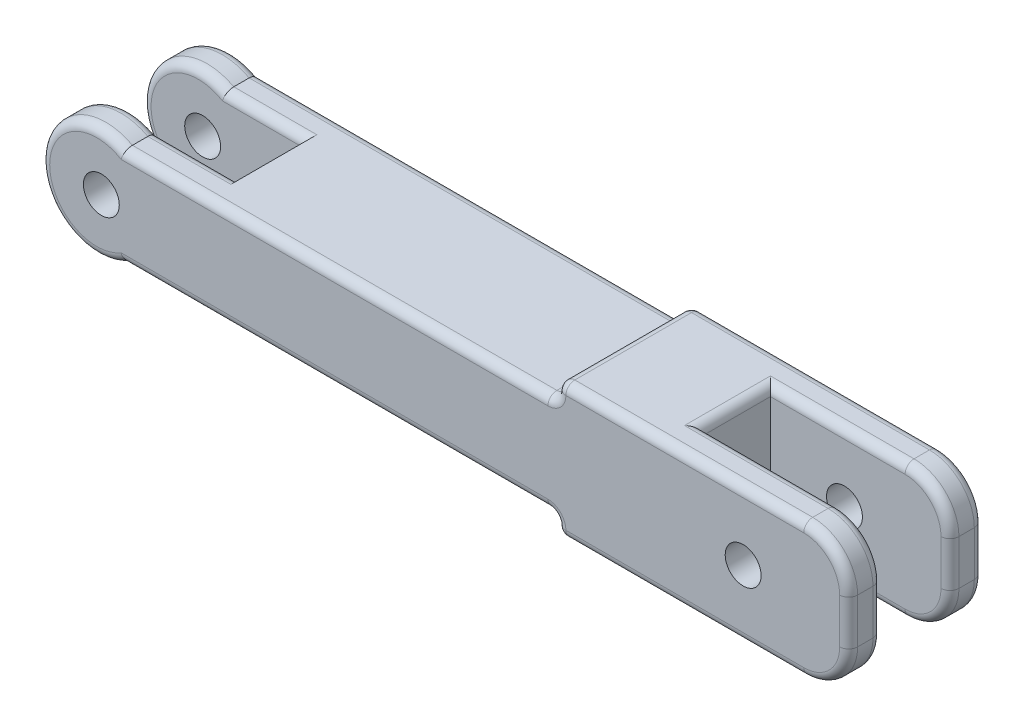
from build123d import *

# Parameters (mm, degrees)
SALIENTE_EXTRUIR1_DEPTH    = 30
REDONDEO1_R                = 10
CORTAR_EXTRUIR1_DEPTH      = 99.3666610188635
CORTAR_EXTRUIR1_DEPTH_BACK = 99.3666610188635
CROQUIS2_W                 = 37.00361962237292
CROQUIS2_H                 = 15.150000000000002
CROQUIS3_R                 = 4.000000000000006
CORTAR_EXTRUIR2_DEPTH      = 97.04686356149273
CORTAR_EXTRUIR3_DEPTH      = 100.498743710662
CORTAR_EXTRUIR3_DEPTH_BACK = 100.498743710662
CROQUIS5_R                 = 4.000000000000006
CORTAR_EXTRUIR4_DEPTH      = 97.04686356149273
REDONDEO2_R                = 2


with BuildPart() as part:
    # Croquis1 → Saliente-Extruir1 (new body)
    with BuildSketch(Plane.XY):
        with BuildLine():
            Line((89.99999999999999, -14.999999999999972), (90, 15.000000000000014))
            Line((90, 15.000000000000014), (25, 15.000000000000007))
            Line((25, 15.000000000000007), (25.000000000000004, 11))
            Line((25.000000000000004, 11), (-24.999999999999996, 11))
            Line((-24.999999999999996, 11), (-71.56282895648103, 11))
            ThreePointArc((-71.56282895648103, 11), (-90, 1.53e-15), (-71.56282895648103, -11))
            Line((-71.56282895648103, -11), (-24.999999999999996, -11))
            Line((-24.999999999999996, -11), (25.000000000000004, -11))
            Line((25.000000000000004, -11), (24.999999999999993, -14.999999999999982))
            Line((24.999999999999993, -14.999999999999982), (89.99999999999999, -14.999999999999972))
        make_face()
    extrude(amount=SALIENTE_EXTRUIR1_DEPTH)

    # Redondeo1
    redondeo1_edges = [part.edges().sort_by_distance(p)[0] for p in [
        (90, 15.000000000000014, 15),
        (89.99999999999999, -14.999999999999972, 15),
    ]]
    fillet(redondeo1_edges, radius=REDONDEO1_R)

    # Croquis2 → Cortar-Extruir1 (cut, two sides: drawn at the far end of the back side and taken through both)
    with BuildSketch(Plane(origin=(0, 11, 0), x_dir=(1, 0, 0), z_dir=(0, 1, 0)).offset(-CORTAR_EXTRUIR1_DEPTH_BACK)):
        with Locations((-71.56282895648103, -14.999999999999998)):
            Rectangle(CROQUIS2_W, CROQUIS2_H)
    extrude(amount=CORTAR_EXTRUIR1_DEPTH + CORTAR_EXTRUIR1_DEPTH_BACK, mode=Mode.SUBTRACT)

    # Croquis3 → Cortar-Extruir2 (cut, through all)
    with BuildSketch(Plane.XY.offset(30)):
        with Locations((-76.50000000000001, 0)):
            Circle(CROQUIS3_R)
    extrude(amount=-CORTAR_EXTRUIR2_DEPTH, mode=Mode.SUBTRACT)

    # Croquis4 → Cortar-Extruir3 (cut, two sides: drawn at the far end of the back side and taken through both)
    with BuildSketch(Plane(origin=(-2e-15, 15.000000000000004, 0), x_dir=(1, 1.3e-16, 0), z_dir=(-1.3e-16, 1, 0)).offset(-CORTAR_EXTRUIR3_DEPTH_BACK)):
        Polygon((109.99999999999997, -7.424999999999999), (49.99999999999999, -7.424999999999999), (49.99999999999999, -22.575), (109.99999999999997, -22.575000000000003), align=None)
    extrude(amount=CORTAR_EXTRUIR3_DEPTH + CORTAR_EXTRUIR3_DEPTH_BACK, mode=Mode.SUBTRACT)

    # Croquis5 → Cortar-Extruir4 (cut, through all)
    with BuildSketch(Plane(origin=(0, 0, 0), x_dir=(-1, 0, 0), z_dir=(0, 0, -1))):
        with Locations((-66.49999999999999, 0)):
            Circle(CROQUIS5_R)
    extrude(amount=-CORTAR_EXTRUIR4_DEPTH, mode=Mode.SUBTRACT)

    # Redondeo2
    redondeo2_edges = [part.edges().sort_by_distance(p)[0] for p in [
        (25.000000000000004, -11, 15),
        (25.000000000000004, 11, 15),
    ]]
    fillet(redondeo2_edges, radius=REDONDEO2_R)
    redondeo2_2_edges = [part.edges().sort_by_distance(p)[0] for p in [
        (52.499999999999986, -14.999999999999977, 0),
        (87.07106781186545, -12.071067811865449, 0),
        (89.99999999999999, 1.421e-14, 0),
        (87.07106781186548, 12.07106781186549, 0),
        (65, 15.00000000000001, 7.424999999999999),
        (87.07106781186548, 12.071067811865488, 7.424999999999999),
        (90, 1.421e-14, 7.424999999999999),
        (87.07106781186545, -12.071067811865456, 7.424999999999999),
        (64.99999999999999, -14.999999999999973, 22.574999999999996),
        (87.07106781186545, -12.071067811865456, 22.575),
        (90, 1.421e-14, 22.575000000000003),
        (87.07106781186548, 12.071067811865488, 22.575),
        (52.5, 15.00000000000001, 30),
        (87.07106781186548, 12.07106781186549, 30),
        (89.99999999999999, 1.421e-14, 30),
        (87.07106781186545, -12.071067811865449, 30),
        (-24.28141447824052, -11, 0),
        (-90, -2.22e-15, 0),
        (-24.28141447824051, 11, 0),
        (52.5, 15.00000000000001, 0),
        (64.99999999999999, -14.999999999999975, 7.424999999999999),
        (50, -14.999999999999977, 15),
        (49.99999999999999, 15.00000000000001, 15),
        (65, 15.00000000000001, 22.575000000000003),
        (-90, -2.22e-15, 30),
        (-24.281414478240514, 11, 30),
        (52.499999999999986, -14.999999999999977, 30),
        (-24.281414478240517, -11, 30),
        (24.999999999999993, -14.999999999999982, 15),
        (25, 15.000000000000007, 15),
        (-90, 4.88e-15, 7.424999999999997),
        (-62.3119240508878, 11, 7.424999999999997),
        (-62.3119240508878, -11, 7.424999999999997),
        (-62.3119240508878, -11, 22.575),
        (-90, 4.88e-15, 22.575),
        (-62.3119240508878, 11, 22.575),
        (24.41421356237309, -11.585786437626908, 30),
        (24.4142135623731, 11.585786437626904, 30),
        (24.4142135623731, 11.585786437626906, 0),
        (24.41421356237309, -11.585786437626906, 0),
    ]]
    fillet(redondeo2_2_edges, radius=REDONDEO2_R - 0.0001)  # a hair under: the kernel refuses the full size


solid = part.part
